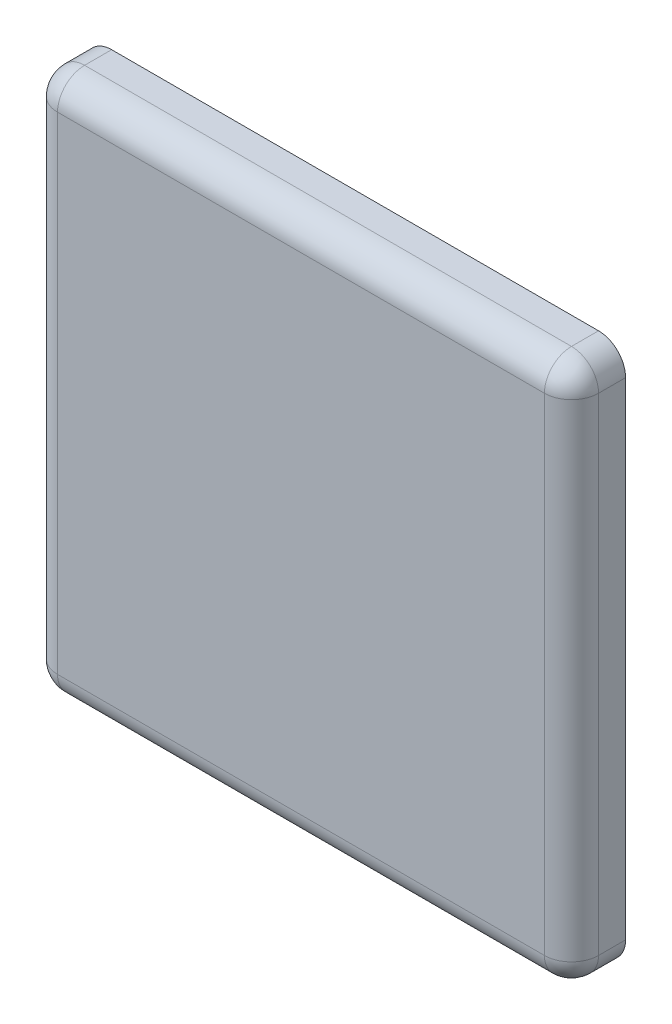
from build123d import *

# Parameters (mm, degrees)
CAP_SKETCH_W            = 20
CAP_SKETCH_H            = 20
EXTRUDE_THICKNESS_DEPTH = 2
CORNER_FILLETS_R        = 1
TOP_EDGE_FILLET_R       = 1


with BuildPart() as part:
    # Cap Sketch → Extrude Thickness (new body)
    with BuildSketch(Plane.XY):
        Rectangle(CAP_SKETCH_W, CAP_SKETCH_H)
    extrude(amount=EXTRUDE_THICKNESS_DEPTH)

    # Corner Fillets
    corner_fillets_edges = [part.edges().sort_by_distance(p)[0] for p in [
        (-10, -10, 1),
        (-10, 10, 1),
        (10, 10, 1),
        (10, -10, 1),
    ]]
    fillet(corner_fillets_edges, radius=CORNER_FILLETS_R)

    # Top Edge Fillet
    top_edge_fillet_edges = [part.edges().sort_by_distance(p)[0] for p in [
        (-9.707106781, 9.707106781, 2),
        (0, 10, 2),
        (9.707106781, 9.707106781, 2),
        (10, 0, 2),
        (9.707106781, -9.707106781, 2),
        (0, -10, 2),
        (-9.707106781, -9.707106781, 2),
        (-10, 0, 2),
    ]]
    fillet(top_edge_fillet_edges, radius=TOP_EDGE_FILLET_R)


solid = part.part
